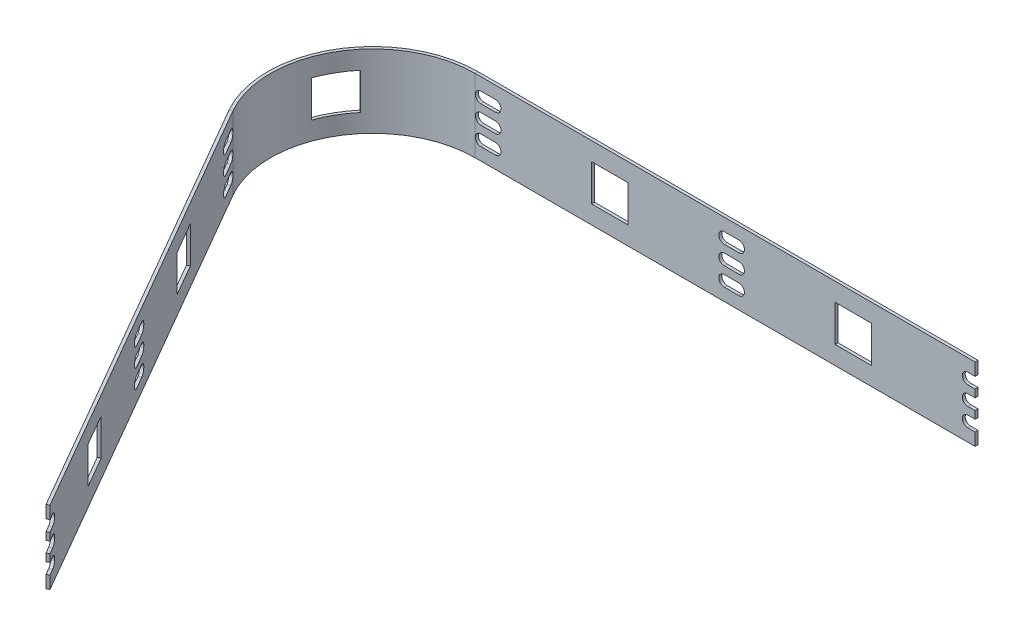
from build123d import *

# Parameters (mm, degrees)
ESQUISSE1_W                 = 33.3
ESQUISSE1_H                 = 10
BOSS_EXTRU_1_DEPTH          = 0.4
ESQUISSE51_W                = 5
ESQUISSE51_H                = 5
BOSS_EXTRU_3_DEPTH          = 1.75
ENL_V_MAT_EXTRU_2_DEPTH     = 0.1
R_P_TITION_LIN_AIRE4_COUNT  = 5
R_P_TITION_LIN_AIRE4_PITCH  = 33.3
CONVERTIR_VOLUME3_OUTLINE_W = 5
CONVERTIR_VOLUME3_OUTLINE_H = 5
CONVERTIR_VOLUME3_DEPTH     = 2.15
PLI_START                   = -5
PLI_ESQUISS_9_DEPTH         = 10
PLI_ESQUISS_9_2_DEPTH       = 10
PLI_ESQUISS_9_3_DEPTH       = 2.5
PLI_START_2                 = 2.5
PLI_ESQUISS_9_4_DEPTH       = 2.5
PLI_START_3                 = 48.955267378
PLI_ESQUISS_9_5_DEPTH       = 0.4


with BuildPart() as part:
    # Esquisse1 → Boss.-Extru.1 (new body)
    with BuildSketch(Plane.XY):
        Rectangle(ESQUISSE1_W, ESQUISSE1_H)
    boss_extru_1 = extrude(amount=BOSS_EXTRU_1_DEPTH)

    # Esquisse51 → Boss.-Extru.3 (add)
    with BuildSketch(Plane.XY.offset(0.4)):
        Rectangle(ESQUISSE51_W, ESQUISSE51_H)
    boss_extru_3 = extrude(amount=BOSS_EXTRU_3_DEPTH)

    # Esquisse52 → Enlèv. mat.-Extru.2 (cut)
    with BuildSketch(Plane.XY.offset(0.4)):
        with BuildLine():
            Line((16.65, 0.75), (15.65, 0.75))
            ThreePointArc((15.65, 0.75), (14.9, 0), (15.65, -0.75))
            Line((15.65, -0.75), (16.65, -0.75))
            Line((16.65, -0.75), (16.65, 0.75))
        make_face()
        with BuildLine():
            Line((16.65, 3.29), (15.65, 3.29))
            ThreePointArc((15.65, 3.29), (14.9, 2.54), (15.65, 1.79))
            Line((15.65, 1.79), (16.65, 1.79))
            Line((16.65, 1.79), (16.65, 3.29))
        make_face()
        with BuildLine():
            Line((16.65, -1.79), (15.65, -1.79))
            ThreePointArc((15.65, -1.79), (14.9, -2.54), (15.65, -3.29))
            Line((15.65, -3.29), (16.65, -3.29))
            Line((16.65, -3.29), (16.65, -1.79))
        make_face()
        with BuildLine():
            Line((-16.65, -3.29), (-15.65, -3.29))
            ThreePointArc((-15.65, -3.29), (-14.9, -2.54), (-15.65, -1.79))
            Line((-15.65, -1.79), (-16.65, -1.79))
            Line((-16.65, -1.79), (-16.65, -3.29))
        make_face()
        with BuildLine():
            Line((-16.65, 1.79), (-15.65, 1.79))
            ThreePointArc((-15.65, 1.79), (-14.9, 2.54), (-15.65, 3.29))
            Line((-15.65, 3.29), (-16.65, 3.29))
            Line((-16.65, 3.29), (-16.65, 1.79))
        make_face()
        with BuildLine():
            Line((-16.65, -0.75), (-15.65, -0.75))
            ThreePointArc((-15.65, -0.75), (-14.9, 0), (-15.65, 0.75))
            Line((-15.65, 0.75), (-16.65, 0.75))
            Line((-16.65, 0.75), (-16.65, -0.75))
        make_face()
    enl_v_mat_extru_2 = extrude(amount=-ENL_V_MAT_EXTRU_2_DEPTH, mode=Mode.SUBTRACT)

    # Répétition linéaire4: Boss.-Extru.1, Boss.-Extru.3, Enlèv. mat.-Extru.2 ×5
    with Locations(*[(i * R_P_TITION_LIN_AIRE4_PITCH, 0, 0) for i in range(1, R_P_TITION_LIN_AIRE4_COUNT)]):
        add(boss_extru_1)
        add(boss_extru_3)
        add(enl_v_mat_extru_2, mode=Mode.SUBTRACT)

    # Convertir-Volume3: read off the stored shape, not the designer's step
    # Convertir-Volume3 outline → Convertir-Volume3 (cut)
    with BuildSketch(Plane.XY):
        with Locations((133.2, 0)):
            Rectangle(CONVERTIR_VOLUME3_OUTLINE_W, CONVERTIR_VOLUME3_OUTLINE_H)
        with Locations((99.9, 0)):
            Rectangle(CONVERTIR_VOLUME3_OUTLINE_W, CONVERTIR_VOLUME3_OUTLINE_H)
        with Locations((66.6, 0)):
            Rectangle(CONVERTIR_VOLUME3_OUTLINE_W, CONVERTIR_VOLUME3_OUTLINE_H)
        with Locations((33.3, 0)):
            Rectangle(CONVERTIR_VOLUME3_OUTLINE_W, CONVERTIR_VOLUME3_OUTLINE_H)
        Rectangle(CONVERTIR_VOLUME3_OUTLINE_W, CONVERTIR_VOLUME3_OUTLINE_H)
        with BuildLine():
            ThreePointArc((50.95, -0.75), (51.7, 0), (50.95, 0.75))
            Line((50.95, 0.75), (48.95, 0.75))
            ThreePointArc((48.95, 0.75), (48.2, 0), (48.95, -0.75))
            Line((48.95, -0.75), (50.95, -0.75))
        make_face()
        with BuildLine():
            Line((149.85, -0.75), (149.85, 0.75))
            Line((149.85, 0.75), (148.85, 0.75))
            ThreePointArc((148.85, 0.75), (148.1, 0), (148.85, -0.75))
            Line((148.85, -0.75), (149.85, -0.75))
        make_face()
        with BuildLine():
            Line((148.85, 1.79), (149.85, 1.79))
            Line((149.85, 1.79), (149.85, 3.29))
            Line((149.85, 3.29), (148.85, 3.29))
            ThreePointArc((148.85, 3.29), (148.1, 2.54), (148.85, 1.79))
        make_face()
        with BuildLine():
            Line((149.85, -3.29), (149.85, -1.79))
            Line((149.85, -1.79), (148.85, -1.79))
            ThreePointArc((148.85, -1.79), (148.1, -2.54), (148.85, -3.29))
            Line((148.85, -3.29), (149.85, -3.29))
        make_face()
        with BuildLine():
            ThreePointArc((-15.65, -0.75), (-14.9, 0), (-15.65, 0.75))
            Line((-15.65, 0.75), (-16.65, 0.75))
            Line((-16.65, 0.75), (-16.65, -0.75))
            Line((-16.65, -0.75), (-15.65, -0.75))
        make_face()
        with BuildLine():
            Line((-15.65, -1.79), (-16.65, -1.79))
            Line((-16.65, -1.79), (-16.65, -3.29))
            Line((-16.65, -3.29), (-15.65, -3.29))
            ThreePointArc((-15.65, -3.29), (-14.9, -2.54), (-15.65, -1.79))
        make_face()
        with BuildLine():
            Line((-16.65, 3.29), (-16.65, 1.79))
            Line((-16.65, 1.79), (-15.65, 1.79))
            ThreePointArc((-15.65, 1.79), (-14.9, 2.54), (-15.65, 3.29))
            Line((-15.65, 3.29), (-16.65, 3.29))
        make_face()
        with BuildLine():
            ThreePointArc((17.65, -0.75), (18.4, 0), (17.65, 0.75))
            Line((17.65, 0.75), (15.65, 0.75))
            ThreePointArc((15.65, 0.75), (14.9, 0), (15.65, -0.75))
            Line((15.65, -0.75), (17.65, -0.75))
        make_face()
        with BuildLine():
            ThreePointArc((84.25, -0.75), (85, 0), (84.25, 0.75))
            Line((84.25, 0.75), (82.25, 0.75))
            ThreePointArc((82.25, 0.75), (81.5, 0), (82.25, -0.75))
            Line((82.25, -0.75), (84.25, -0.75))
        make_face()
        with BuildLine():
            ThreePointArc((117.55, -0.75), (118.3, 0), (117.55, 0.75))
            Line((117.55, 0.75), (115.55, 0.75))
            ThreePointArc((115.55, 0.75), (114.8, 0), (115.55, -0.75))
            Line((115.55, -0.75), (117.55, -0.75))
        make_face()
        with BuildLine():
            ThreePointArc((82.25, 3.29), (81.5, 2.54), (82.25, 1.79))
            Line((82.25, 1.79), (84.25, 1.79))
            ThreePointArc((84.25, 1.79), (85, 2.54), (84.25, 3.29))
            Line((84.25, 3.29), (82.25, 3.29))
        make_face()
        with BuildLine():
            ThreePointArc((48.95, 3.29), (48.2, 2.54), (48.95, 1.79))
            Line((48.95, 1.79), (50.95, 1.79))
            ThreePointArc((50.95, 1.79), (51.7, 2.54), (50.95, 3.29))
            Line((50.95, 3.29), (48.95, 3.29))
        make_face()
        with BuildLine():
            ThreePointArc((115.55, 3.29), (114.8, 2.54), (115.55, 1.79))
            Line((115.55, 1.79), (117.55, 1.79))
            ThreePointArc((117.55, 1.79), (118.3, 2.54), (117.55, 3.29))
            Line((117.55, 3.29), (115.55, 3.29))
        make_face()
        with BuildLine():
            ThreePointArc((15.65, 3.29), (14.9, 2.54), (15.65, 1.79))
            Line((15.65, 1.79), (17.65, 1.79))
            ThreePointArc((17.65, 1.79), (18.4, 2.54), (17.65, 3.29))
            Line((17.65, 3.29), (15.65, 3.29))
        make_face()
        with BuildLine():
            ThreePointArc((84.25, -3.29), (85, -2.54), (84.25, -1.79))
            Line((84.25, -1.79), (82.25, -1.79))
            ThreePointArc((82.25, -1.79), (81.5, -2.54), (82.25, -3.29))
            Line((82.25, -3.29), (84.25, -3.29))
        make_face()
        with BuildLine():
            ThreePointArc((17.65, -3.29), (18.4, -2.54), (17.65, -1.79))
            Line((17.65, -1.79), (15.65, -1.79))
            ThreePointArc((15.65, -1.79), (14.9, -2.54), (15.65, -3.29))
            Line((15.65, -3.29), (17.65, -3.29))
        make_face()
        with BuildLine():
            ThreePointArc((50.95, -3.29), (51.7, -2.54), (50.95, -1.79))
            Line((50.95, -1.79), (48.95, -1.79))
            ThreePointArc((48.95, -1.79), (48.2, -2.54), (48.95, -3.29))
            Line((48.95, -3.29), (50.95, -3.29))
        make_face()
        with BuildLine():
            ThreePointArc((117.55, -3.29), (118.3, -2.54), (117.55, -1.79))
            Line((117.55, -1.79), (115.55, -1.79))
            ThreePointArc((115.55, -1.79), (114.8, -2.54), (115.55, -3.29))
            Line((115.55, -3.29), (117.55, -3.29))
        make_face()
    extrude(amount=CONVERTIR_VOLUME3_DEPTH, mode=Mode.SUBTRACT)

    # Pli esquissé9: read off the stored shape, not the designer's step
    # Pli esquissé9 outline → Pli esquissé9 (cut)
    with BuildSketch(Plane(origin=(0, 0, 0), x_dir=(1, 0, 0), z_dir=(0, 1, 0)).offset(PLI_START)):
        with BuildLine():
            ThreePointArc((78.099745317, -0.4), (79.773148952, -0.100349655), (81.470205227, 0))
            Line((81.470205227, 0), (-16.65, 0))
            Line((-16.65, 0), (-16.65, -0.4))
            Line((-16.65, -0.4), (78.099745317, -0.4))
        make_face()
    extrude(amount=PLI_ESQUISS_9_DEPTH, mode=Mode.SUBTRACT)

    # Pli esquiss_9 2 outline → Pli esquiss_9 2 (add)
    with BuildSketch(Plane(origin=(0, 0, 0), x_dir=(1, 0, 0), z_dir=(0, 1, 0)).offset(PLI_START)):
        Polygon((96.114336799, -68.564379915), (103.189336799, -80.818639379), (103.535746961, -80.618639379), (96.460746961, -68.364379915), align=None)
        Polygon((79.464336799, -39.725733969), (93.614336799, -64.234252897), (93.960746961, -64.034252897), (79.810746961, -39.525733969), align=None)
        with BuildLine():
            Line((68.999439412, -21.6), (76.964336798, -35.39560695))
            Line((76.964336798, -35.39560695), (77.310746961, -35.19560695))
            Line((77.310746961, -35.19560695), (69.345849574, -21.4))
            ThreePointArc((69.345849574, -21.4), (67.524412919, -15.630803354), (68.307229274, -9.631765099))
            Line((68.307229274, -9.631765099), (67.931144247, -9.495529816))
            ThreePointArc((67.931144247, -9.495529816), (67.125961709, -15.665969164), (68.999439412, -21.6))
        make_face()
        with BuildLine():
            ThreePointArc((78.099745317, -0.4), (73.898184062, -2.151551303), (70.453278966, -5.12706434))
            Line((70.453278966, -5.12706434), (70.759304695, -5.384645886))
            ThreePointArc((70.759304695, -5.384645886), (75.563216044, -1.707187908), (81.470205227, -0.4))
            Line((81.470205227, -0.4), (78.099745317, -0.4))
        make_face()
    extrude(amount=PLI_ESQUISS_9_2_DEPTH)

    # Pli esquiss_9 3 outline → Pli esquiss_9 3 (add)
    with BuildSketch(Plane(origin=(0, 0, 0), x_dir=(1, 0, 0), z_dir=(0, 1, 0)).offset(PLI_START)):
        Polygon((93.614336799, -64.234252897), (96.114336799, -68.564379915), (96.460746961, -68.364379915), (93.960746961, -64.034252897), align=None)
        Polygon((76.964336798, -35.39560695), (79.464336799, -39.725733969), (79.810746961, -39.525733969), (77.31074696, -35.19560695), align=None)
        with BuildLine():
            ThreePointArc((70.453278966, -5.12706434), (68.999439412, -7.2), (67.931144247, -9.495529816))
            Line((67.931144247, -9.495529816), (68.307229274, -9.631765099))
            ThreePointArc((68.307229274, -9.631765099), (69.345849574, -7.4), (70.759304695, -5.384645886))
            Line((70.759304695, -5.384645886), (70.453278966, -5.12706434))
        make_face()
    extrude(amount=PLI_ESQUISS_9_3_DEPTH)

    # Pli esquiss_9 4 outline → Pli esquiss_9 4 (add)
    with BuildSketch(Plane(origin=(0, 0, 0), x_dir=(1, 0, 0), z_dir=(0, 1, 0)).offset(PLI_START_2)):
        Polygon((93.614336799, -64.234252897), (96.114336799, -68.564379915), (96.460746961, -68.364379915), (93.960746961, -64.034252897), align=None)
        Polygon((76.964336798, -35.39560695), (79.464336799, -39.725733969), (79.810746961, -39.525733969), (77.31074696, -35.19560695), align=None)
        with BuildLine():
            ThreePointArc((70.453278966, -5.12706434), (68.999439412, -7.2), (67.931144247, -9.495529816))
            Line((67.931144247, -9.495529816), (68.307229274, -9.631765099))
            ThreePointArc((68.307229274, -9.631765099), (69.345849574, -7.4), (70.759304695, -5.384645886))
            Line((70.759304695, -5.384645886), (70.453278966, -5.12706434))
        make_face()
    extrude(amount=PLI_ESQUISS_9_4_DEPTH)

    # Pli esquiss_9 5 outline → Pli esquiss_9 5 (cut)
    with BuildSketch(Plane(origin=(0, 0, 0), x_dir=(0.500000000000004, 0, 0.8660254037844363), z_dir=(0.8660254037844363, 0, -0.5000000000000042)).offset(PLI_START_3)):
        with BuildLine():
            ThreePointArc((53.985663201, 0.75), (53.235663201, 0), (53.985663201, -0.75))
            Line((53.985663201, -0.75), (55.985663201, -0.75))
            ThreePointArc((55.985663201, -0.75), (56.735663201, 0), (55.985663201, 0.75))
            Line((55.985663201, 0.75), (53.985663201, 0.75))
        make_face()
        with BuildLine():
            ThreePointArc((120.585663201, 0.75), (119.835663201, 0), (120.585663201, -0.75))
            Line((120.585663201, -0.75), (121.585663201, -0.75))
            Line((121.585663201, -0.75), (121.585663201, 0.75))
            Line((121.585663201, 0.75), (120.585663201, 0.75))
        make_face()
        with BuildLine():
            Line((120.585663201, 1.79), (121.585663201, 1.79))
            Line((121.585663201, 1.79), (121.585663201, 3.29))
            Line((121.585663201, 3.29), (120.585663201, 3.29))
            ThreePointArc((120.585663201, 3.29), (119.835663201, 2.54), (120.585663201, 1.79))
        make_face()
        with BuildLine():
            Line((121.585663201, -3.29), (121.585663201, -1.79))
            Line((121.585663201, -1.79), (120.585663201, -1.79))
            ThreePointArc((120.585663201, -1.79), (119.835663201, -2.54), (120.585663201, -3.29))
            Line((120.585663201, -3.29), (121.585663201, -3.29))
        make_face()
        with BuildLine():
            ThreePointArc((87.285663201, 0.75), (86.535663201, 0), (87.285663201, -0.75))
            Line((87.285663201, -0.75), (89.285663201, -0.75))
            ThreePointArc((89.285663201, -0.75), (90.035663201, 0), (89.285663201, 0.75))
            Line((89.285663201, 0.75), (87.285663201, 0.75))
        make_face()
        with BuildLine():
            ThreePointArc((87.285663201, -1.79), (86.535663201, -2.54), (87.285663201, -3.29))
            Line((87.285663201, -3.29), (89.285663201, -3.29))
            ThreePointArc((89.285663201, -3.29), (90.035663201, -2.54), (89.285663201, -1.79))
            Line((89.285663201, -1.79), (87.285663201, -1.79))
        make_face()
        with BuildLine():
            ThreePointArc((53.985663201, -1.79), (53.235663201, -2.54), (53.985663201, -3.29))
            Line((53.985663201, -3.29), (55.985663201, -3.29))
            ThreePointArc((55.985663201, -3.29), (56.735663201, -2.54), (55.985663201, -1.79))
            Line((55.985663201, -1.79), (53.985663201, -1.79))
        make_face()
        with BuildLine():
            ThreePointArc((87.285663201, 3.29), (86.535663201, 2.54), (87.285663201, 1.79))
            Line((87.285663201, 1.79), (89.285663201, 1.79))
            ThreePointArc((89.285663201, 1.79), (90.035663201, 2.54), (89.285663201, 3.29))
            Line((89.285663201, 3.29), (87.285663201, 3.29))
        make_face()
        with BuildLine():
            ThreePointArc((53.985663201, 3.29), (53.235663201, 2.54), (53.985663201, 1.79))
            Line((53.985663201, 1.79), (55.985663201, 1.79))
            ThreePointArc((55.985663201, 1.79), (56.735663201, 2.54), (55.985663201, 3.29))
            Line((55.985663201, 3.29), (53.985663201, 3.29))
        make_face()
    extrude(amount=PLI_ESQUISS_9_5_DEPTH, mode=Mode.SUBTRACT)


solid = part.part
